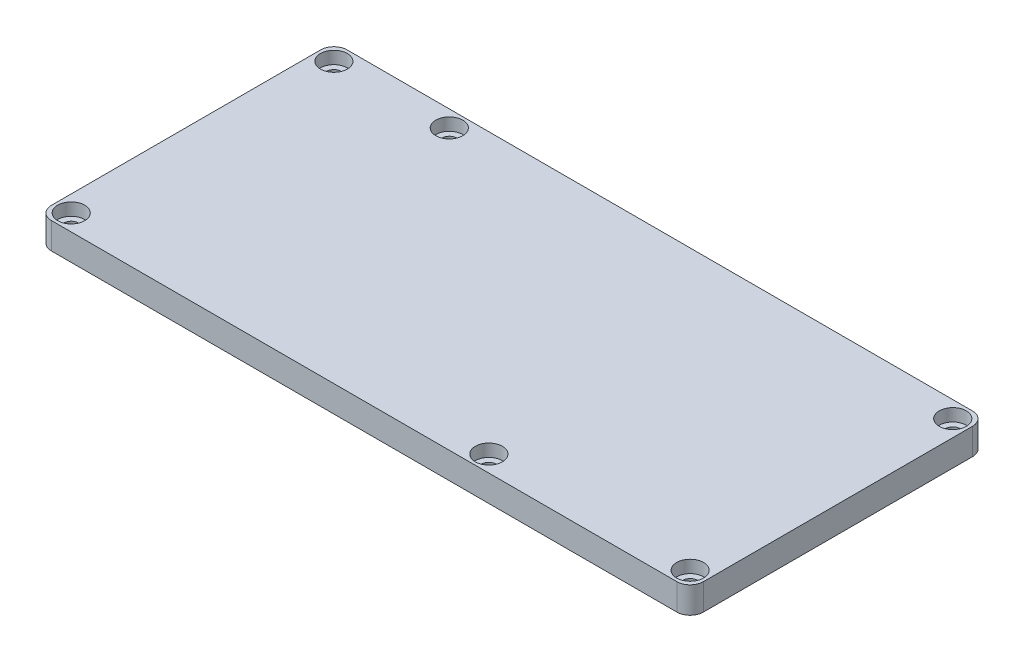
from build123d import *

# Parameters (mm, degrees)
SKETCH1_W                      = 156.894022
SKETCH1_H                      = 71.14794
BOSS_EXTRUDE1_DEPTH            = 6.35
FILLET1_R                      = 3.175
CBORE_FOR_M3_SHCS1_D           = 3.6
CBORE_FOR_M3_SHCS1_CBORE_D     = 6.5
CBORE_FOR_M3_SHCS1_CBORE_DEPTH = 3
SHELL1_DEPTH                   = 3.175
SHELL1_2_DEPTH                 = 0.175
SKETCH8_W                      = 7.62
SKETCH8_H                      = 6.858
BOSS_EXTRUDE2_DEPTH            = 6.35
SKETCH9_R                      = 5.842
BOSS_EXTRUDE3_DEPTH            = 3.175
CUT_EXTRUDE2_START             = -1.5875
SKETCH10_R                     = 4.318
CUT_EXTRUDE2_DEPTH             = 2.794


# Read off the part's stored shape, not the designer's step: Shell1
with BuildPart() as part:
    # Sketch1 → Boss-Extrude1 (new body)
    with BuildSketch(Plane(origin=(0, 0, 0), x_dir=(1, 0, 0), z_dir=(0, 1, 0))):
        with Locations((78.447011, 35.57397)):
            Rectangle(SKETCH1_W, SKETCH1_H)
    extrude(amount=BOSS_EXTRUDE1_DEPTH)

    # Fillet1
    fillet1_edges = [part.edges().sort_by_distance(p)[0] for p in [
        (0, 3.175, -71.14794),
        (156.894022, 3.175, -71.14794),
        (156.894022, 3.175, 0),
        (0, 3.175, 0),
    ]]
    fillet(fillet1_edges, radius=FILLET1_R)

    # CBORE for M3 SHCS1 (through all)
    with Locations(Plane(origin=(0, 6.35, 0), x_dir=(1, 0, 0), z_dir=(0, 1, 0))):
        with Locations((3.96875, 67.17919), (31.75, 67.17919), (152.92524554, 67.17919), (3.96875, 3.96875), (104.48544, 3.96875), (152.92524554, 3.96875)):
            CounterBoreHole(CBORE_FOR_M3_SHCS1_D / 2, CBORE_FOR_M3_SHCS1_CBORE_D / 2, CBORE_FOR_M3_SHCS1_CBORE_DEPTH)

    # Shell1 outline → Shell1 (cut)
    with BuildSketch(Plane(origin=(0, 0, 0), x_dir=(1, 0, 0), z_dir=(0, 1, 0))):
        with BuildLine():
            Line((25.374218798, 67.97294), (10.344531202, 67.97294))
            ThreePointArc((10.344531202, 67.97294), (8.511911069, 62.636028931), (3.175, 60.803408798))
            Line((3.175, 60.803408798), (3.175, 10.344531202))
            ThreePointArc((3.175, 10.344531202), (8.511911069, 8.511911069), (10.344531202, 3.175))
            Line((10.344531202, 3.175), (98.109658798, 3.175))
            ThreePointArc((98.109658798, 3.175), (104.48544, 10.39375), (110.861221202, 3.175))
            Line((110.861221202, 3.175), (146.549464337, 3.175))
            ThreePointArc((146.549464337, 3.175), (148.382093898, 8.511920497), (153.719022, 10.344527908))
            Line((153.719022, 10.344527908), (153.719022, 60.803412092))
            ThreePointArc((153.719022, 60.803412092), (148.382093898, 62.636019503), (146.549464337, 67.97294))
            Line((146.549464337, 67.97294), (38.125781202, 67.97294))
            ThreePointArc((38.125781202, 67.97294), (31.75, 60.75419), (25.374218798, 67.97294))
        make_face()
    extrude(amount=SHELL1_DEPTH, mode=Mode.SUBTRACT)

    # Shell1 2 outline → Shell1 2 (cut)
    with BuildSketch(Plane(origin=(0, 0, 0), x_dir=(1, 0, 0), z_dir=(0, 1, 0))):
        with BuildLine():
            Line((10.344531202, 67.97294), (8.880021316, 67.97294))
            ThreePointArc((8.880021316, 67.97294), (7.486606236, 63.661333764), (3.175, 62.267918684))
            Line((3.175, 62.267918684), (3.175, 60.803408798))
            ThreePointArc((3.175, 60.803408798), (8.511911069, 62.636028931), (10.344531202, 67.97294))
        make_face()
        with BuildLine():
            Line((26.838728684, 67.97294), (25.374218798, 67.97294))
            ThreePointArc((25.374218798, 67.97294), (31.75, 60.75419), (38.125781202, 67.97294))
            Line((38.125781202, 67.97294), (36.661271316, 67.97294))
            ThreePointArc((36.661271316, 67.97294), (31.75, 62.20419), (26.838728684, 67.97294))
        make_face()
        with BuildLine():
            ThreePointArc((10.344531202, 3.175), (8.511911069, 8.511911069), (3.175, 10.344531202))
            Line((3.175, 10.344531202), (3.175, 8.880021316))
            ThreePointArc((3.175, 8.880021316), (7.486606236, 7.486606236), (8.880021316, 3.175))
            Line((8.880021316, 3.175), (10.344531202, 3.175))
        make_face()
        with BuildLine():
            Line((148.013974224, 67.97294), (146.549464337, 67.97294))
            ThreePointArc((146.549464337, 67.97294), (148.382093898, 62.636019503), (153.719022, 60.803412092))
            Line((153.719022, 60.803412092), (153.719022, 62.267922961))
            ThreePointArc((153.719022, 62.267922961), (149.40739878, 63.661324287), (148.013974224, 67.97294))
        make_face()
        with BuildLine():
            ThreePointArc((110.861221202, 3.175), (104.48544, 10.39375), (98.109658798, 3.175))
            Line((98.109658798, 3.175), (99.574168684, 3.175))
            ThreePointArc((99.574168684, 3.175), (104.48544, 8.94375), (109.396711316, 3.175))
            Line((109.396711316, 3.175), (110.861221202, 3.175))
        make_face()
        with BuildLine():
            Line((153.719022, 8.880017039), (153.719022, 10.344527908))
            ThreePointArc((153.719022, 10.344527908), (148.382093898, 8.511920497), (146.549464337, 3.175))
            Line((146.549464337, 3.175), (148.013974224, 3.175))
            ThreePointArc((148.013974224, 3.175), (149.40739878, 7.486615713), (153.719022, 8.880017039))
        make_face()
    extrude(amount=SHELL1_2_DEPTH, mode=Mode.SUBTRACT)

    # Sketch8 → Boss-Extrude2 (add)
    with BuildSketch(Plane.XZ.offset(-3.175)):
        with Locations((15.875, -11.684)):
            Rectangle(SKETCH8_W, SKETCH8_H)
        with Locations((15.875, -35.06597)):
            Rectangle(SKETCH8_W, SKETCH8_H)
        with Locations((15.875, -58.44794)):
            Rectangle(SKETCH8_W, SKETCH8_H)
        with Locations((129.89596777, -35.58794)):
            Rectangle(SKETCH8_W, SKETCH8_H)
    extrude(amount=BOSS_EXTRUDE2_DEPTH)

    # Sketch9 → Boss-Extrude3 (add)
    with BuildSketch(Plane.XZ.offset(-3.175)):
        with Locations((5.842, -23.374985)):
            Circle(SKETCH9_R)
        with Locations((5.842, -46.756955)):
            Circle(SKETCH9_R)
        with Locations((31.75, -5.842)):
            Circle(SKETCH9_R)
        with Locations((104.48544, -65.30594)):
            Circle(SKETCH9_R)
        with Locations((151.052022, -35.58794)):
            Circle(SKETCH9_R)
    extrude(amount=BOSS_EXTRUDE3_DEPTH)

    # Sketch10 → Cut-Extrude2 (cut)
    with BuildSketch(Plane(origin=(0, 6.35, 0), x_dir=(1, 0, 0), z_dir=(0, 1, 0)).offset(CUT_EXTRUDE2_START)):
        with Locations(Location((31.75, 5.842, 0), (0, 0, 270))):
            Circle(SKETCH10_R)
        with Locations(Location((5.842, 23.374985, 0), (0, 0, 270))):
            Circle(SKETCH10_R)
        with Locations(Location((5.842, 46.756955, 0), (0, 0, 270))):
            Circle(SKETCH10_R)
        with Locations(Location((104.48544, 65.30594, 0), (0, 0, 270))):
            Circle(SKETCH10_R)
        with Locations(Location((151.052022, 35.58794, 0), (0, 0, 270))):
            Circle(SKETCH10_R)
    extrude(amount=-CUT_EXTRUDE2_DEPTH, mode=Mode.SUBTRACT)


solid = part.part
